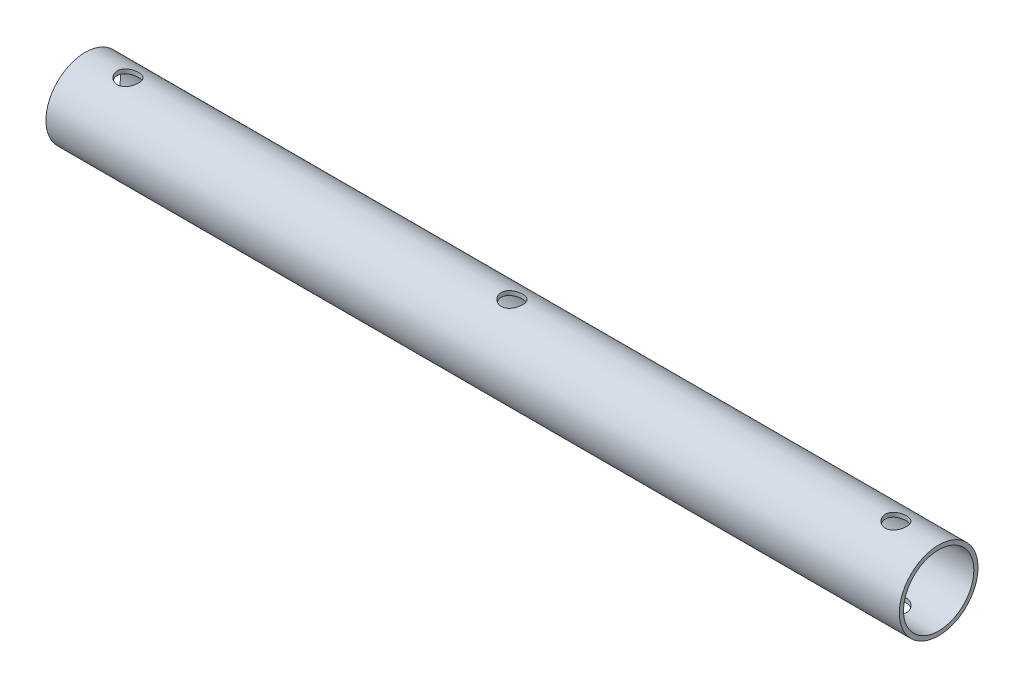
from build123d import *

# Parameters (mm, degrees)
SKETCH3_R               = 11.7094
SKETCH3_R_2             = 10.4648
BOSS_EXTRUDE1_DEPTH     = 254
CUT_EXTRUDE1_DEPTH      = 255.539230958
CUT_EXTRUDE1_DEPTH_BACK = 255.539230958
SKETCH4_R               = 3.175


with BuildPart() as part:
    # Sketch3 → Boss-Extrude1 (new body)
    with BuildSketch(Plane(origin=(0, 0, 0), x_dir=(0, 0, -1), z_dir=(1, 0, 0))):
        Circle(SKETCH3_R)
        Circle(SKETCH3_R_2, mode=Mode.SUBTRACT)
    extrude(amount=BOSS_EXTRUDE1_DEPTH)

    # Sketch4 → Cut-Extrude1 (cut, two sides: drawn at the far end of the back side and taken through both)
    with BuildSketch(Plane(origin=(0, 0, 0), x_dir=(1, 0, 0), z_dir=(0, 1, 0)).offset(-CUT_EXTRUDE1_DEPTH_BACK)):
        with Locations((127, 0)):
            Circle(SKETCH4_R)
        with Locations((12.7, 0)):
            Circle(SKETCH4_R)
        with Locations((241.3, 0)):
            Circle(SKETCH4_R)
    extrude(amount=CUT_EXTRUDE1_DEPTH + CUT_EXTRUDE1_DEPTH_BACK, mode=Mode.SUBTRACT)


solid = part.part
